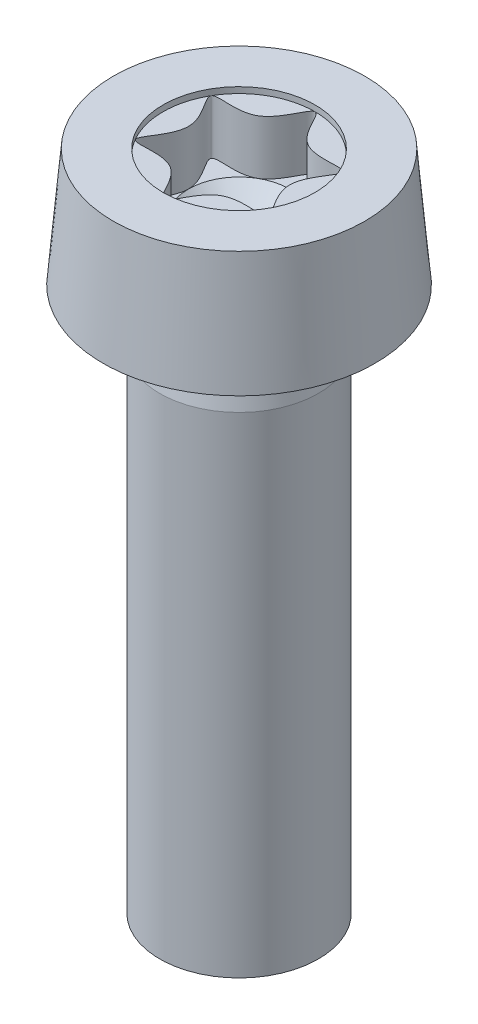
from build123d import *

# Parameters (mm, degrees)
FILLET1_R                 = 0.1
SOCKET_CUT_EXTRUDE1_DEPTH = 1.33
SKETCH3_R                 = 1.675
SOCKET_CUT_EXTRUDE2_DEPTH = 0.133


with BuildPart() as part:
    # Sketch1 → Body-Revolve (revolve)
    with BuildSketch(Plane.XY):
        Polygon((0, 14.6), (2.772529475, 14.6), (3, 12), (1.75, 12), (1.51, 12), (1.75, 10.8), (1.75, 0), (0, 0), align=None)
    revolve(axis=Axis((0, 0, 0), (0, 1, 0)))

    # Fillet1
    fillet1_edges = [part.edges().sort_by_distance(p)[0] for p in [
        (-1.51, 12, 0),
    ]]
    fillet(fillet1_edges, radius=FILLET1_R)

    # Sketch2 → Socket-Cut-Extrude1 (cut)
    with BuildSketch(Plane(origin=(0, 14.6, 0), x_dir=(-1, 0, 0), z_dir=(0, 1, 0))):
        with BuildLine():
            add(Edge.make_bspline(
                [(0, -1.675), (-0.120421659, -1.675), (-0.361264976, -0.625729294), (-1.904940095, -1.099817677), (-0.722529953, 0), (-1.904940095, 1.099817677), (-0.361264976, 0.625729294), (0, 2.199635353), (0.361264976, 0.625729294), (1.904940095, 1.099817677), (0.722529953, 0), (1.904940095, -1.099817677), (0.361264976, -0.625729294), (0.120421659, -1.675), (0, -1.675)],
                knots=[0, 0, 0, 0, 0.083333333, 0.166666667, 0.25, 0.333333333, 0.416666667, 0.5, 0.583333333, 0.666666667, 0.75, 0.833333333, 0.916666667, 1, 1, 1, 1], degree=3))
        make_face()
    extrude(amount=-SOCKET_CUT_EXTRUDE1_DEPTH, mode=Mode.SUBTRACT)

    # Sketch3 → Socket-Cut-Extrude2 (cut)
    with BuildSketch(Plane(origin=(0, 14.6, 0), x_dir=(-1, 0, 0), z_dir=(0, 1, 0))):
        Circle(SKETCH3_R)
    extrude(amount=-SOCKET_CUT_EXTRUDE2_DEPTH, mode=Mode.SUBTRACT)

    # Sketch4 → Drill-Cut-Revolve (revolve, cut)
    with BuildSketch(Plane.XY):
        Polygon((0, 13.27), (1.116666667, 13.27), (0, 12.26), align=None)
    revolve(axis=Axis((0, 0, 0), (0, 1, 0)), mode=Mode.SUBTRACT)


solid = part.part
